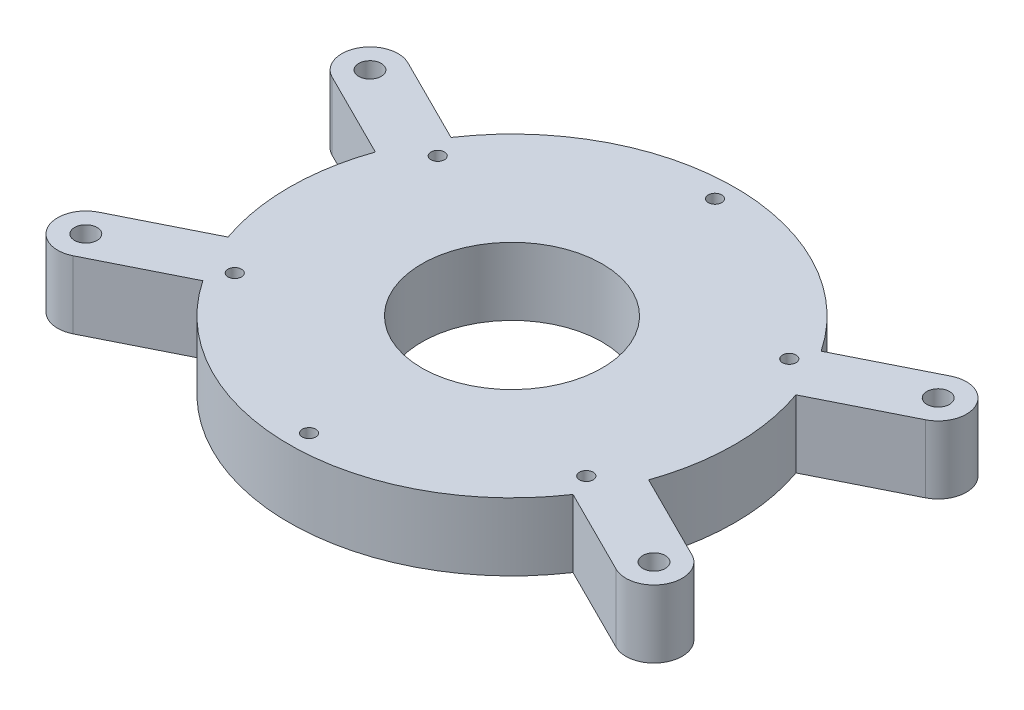
from build123d import *

# Parameters (mm, degrees)
SKETCH_1_R               = 20
EXTRUDE_1_DEPTH          = 15
SKETCH_2_R               = 2.5
CUT_EXTRUDE_1_DEPTH      = 10
MIRROR_2_COPY_1_SKETCH_R = 2.5
MIRROR_2_COPY_1_DEPTH    = 10
MIRROR_2_COPY_2_SKETCH_R = 2.5
MIRROR_2_COPY_2_DEPTH    = 10
SKETCH_3_R               = 2.5
CUT_EXTRUDE_2_DEPTH      = 10
MIRROR_4_COPY_1_SKETCH_R = 2.5
MIRROR_4_COPY_1_DEPTH    = 10
MIRROR_4_COPY_2_SKETCH_R = 2.5
MIRROR_4_COPY_2_DEPTH    = 10
SKETCH_4_R               = 1.5
CUT_EXTRUDE_3_DEPTH      = 87.365727496
PATTERN_CIRCULAR_1_COUNT = 6


with BuildPart() as part:
    # 草图1 → 凸台-拉伸1 (new body)
    with BuildSketch(Plane(origin=(0, 0, 0), x_dir=(1, 0, 0), z_dir=(0, 1, 0))):
        with BuildLine():
            Line((46.623322285, 16.328680875), (65.781966365, 25.910071498))
            ThreePointArc((65.781966365, 25.910071498), (68.576327064, 34.295567803), (60.190830759, 37.089928502))
            Line((60.190830759, 37.089928502), (41.03218668, 27.50853788))
            ThreePointArc((41.03218668, 27.50853788), (0, 49.4), (-41.03218668, 27.50853788))
            Line((-41.03218668, 27.50853788), (-60.190830759, 37.089928502))
            ThreePointArc((-60.190830759, 37.089928502), (-68.576327064, 34.295567803), (-65.781966365, 25.910071498))
            Line((-65.781966365, 25.910071498), (-46.623322285, 16.328680875))
            ThreePointArc((-46.623322285, 16.328680875), (-49.4, 0), (-46.623322285, -16.328680875))
            Line((-46.623322285, -16.328680875), (-65.781966365, -25.910071498))
            ThreePointArc((-65.781966365, -25.910071498), (-68.576327064, -34.295567803), (-60.190830759, -37.089928502))
            Line((-60.190830759, -37.089928502), (-41.03218668, -27.50853788))
            ThreePointArc((-41.03218668, -27.50853788), (0, -49.4), (41.03218668, -27.50853788))
            Line((41.03218668, -27.50853788), (60.190830759, -37.089928502))
            ThreePointArc((60.190830759, -37.089928502), (68.576327064, -34.295567803), (65.781966365, -25.910071498))
            Line((65.781966365, -25.910071498), (46.623322285, -16.328680875))
            ThreePointArc((46.623322285, -16.328680875), (49.4, 0), (46.623322285, 16.328680875))
        make_face()
        Circle(SKETCH_1_R, mode=Mode.SUBTRACT)
    extrude(amount=EXTRUDE_1_DEPTH)

    # 草图2 → 切除-拉伸1 (cut)
    with BuildSketch(Plane(origin=(0, 15, 0), x_dir=(1, 0, 0), z_dir=(0, 1, 0))):
        with Locations((-62.986398562, 31.5)):
            Circle(SKETCH_2_R)
    cut_extrude_1 = extrude(amount=-CUT_EXTRUDE_1_DEPTH, mode=Mode.SUBTRACT)

    # 镜向1: 切除-拉伸1 across plane
    add(cut_extrude_1.mirror(Plane.XY), mode=Mode.SUBTRACT)

    # 镜向2 copy 1 sketch → 镜向2 copy 1 (cut)
    with BuildSketch(Plane(origin=(0, 15, 0), x_dir=(-1, 0, 0), z_dir=(0, 1, 0))):
        with Locations((-62.986398562, 31.5)):
            Circle(MIRROR_2_COPY_1_SKETCH_R)
    extrude(amount=-MIRROR_2_COPY_1_DEPTH, mode=Mode.SUBTRACT)

    # 镜向2 copy 2 sketch → 镜向2 copy 2 (cut)
    with BuildSketch(Plane(origin=(0, 15, 0), x_dir=(-1, 0, 0), z_dir=(0, 1, 0))):
        with Locations((-62.986398562, -31.5)):
            Circle(MIRROR_2_COPY_2_SKETCH_R)
    extrude(amount=-MIRROR_2_COPY_2_DEPTH, mode=Mode.SUBTRACT)

    # 草图3 → 切除-拉伸2 (cut)
    with BuildSketch(Plane.XZ):
        with Locations((-54.042512958, 27.027091516)):
            Circle(SKETCH_3_R)
    cut_extrude_2 = extrude(amount=-CUT_EXTRUDE_2_DEPTH, mode=Mode.SUBTRACT)

    # 镜向3: 切除-拉伸2 across plane
    add(cut_extrude_2.mirror(Plane(origin=(0, 0, 0), x_dir=(0, 0, 1), z_dir=(1, 0, 0))), mode=Mode.SUBTRACT)

    # 镜向4 copy 1 sketch → 镜向4 copy 1 (cut)
    with BuildSketch(Plane(origin=(0, 0, 0), x_dir=(-1, 0, 0), z_dir=(0, -1, 0))):
        with Locations((-54.042512958, 27.027091516)):
            Circle(MIRROR_4_COPY_1_SKETCH_R)
    extrude(amount=-MIRROR_4_COPY_1_DEPTH, mode=Mode.SUBTRACT)

    # 镜向4 copy 2 sketch → 镜向4 copy 2 (cut)
    with BuildSketch(Plane.XZ):
        with Locations((-54.042512958, -27.027091516)):
            Circle(MIRROR_4_COPY_2_SKETCH_R)
    extrude(amount=-MIRROR_4_COPY_2_DEPTH, mode=Mode.SUBTRACT)

    # 草图4 → 切除-拉伸3 (cut, through all)
    with BuildSketch(Plane.XZ):
        with Locations((0, -45)):
            Circle(SKETCH_4_R)
    cut_extrude_3 = extrude(amount=-CUT_EXTRUDE_3_DEPTH, mode=Mode.SUBTRACT)

    # 阵列(圆周)1: 切除-拉伸3 ×6 about axis
    pattern_circular_1_axis = Axis((0, 0, 0), (0, 1, 0))
    for i in range(1, PATTERN_CIRCULAR_1_COUNT):
        add(cut_extrude_3.rotate(pattern_circular_1_axis, i * 360 / PATTERN_CIRCULAR_1_COUNT), mode=Mode.SUBTRACT)


solid = part.part
